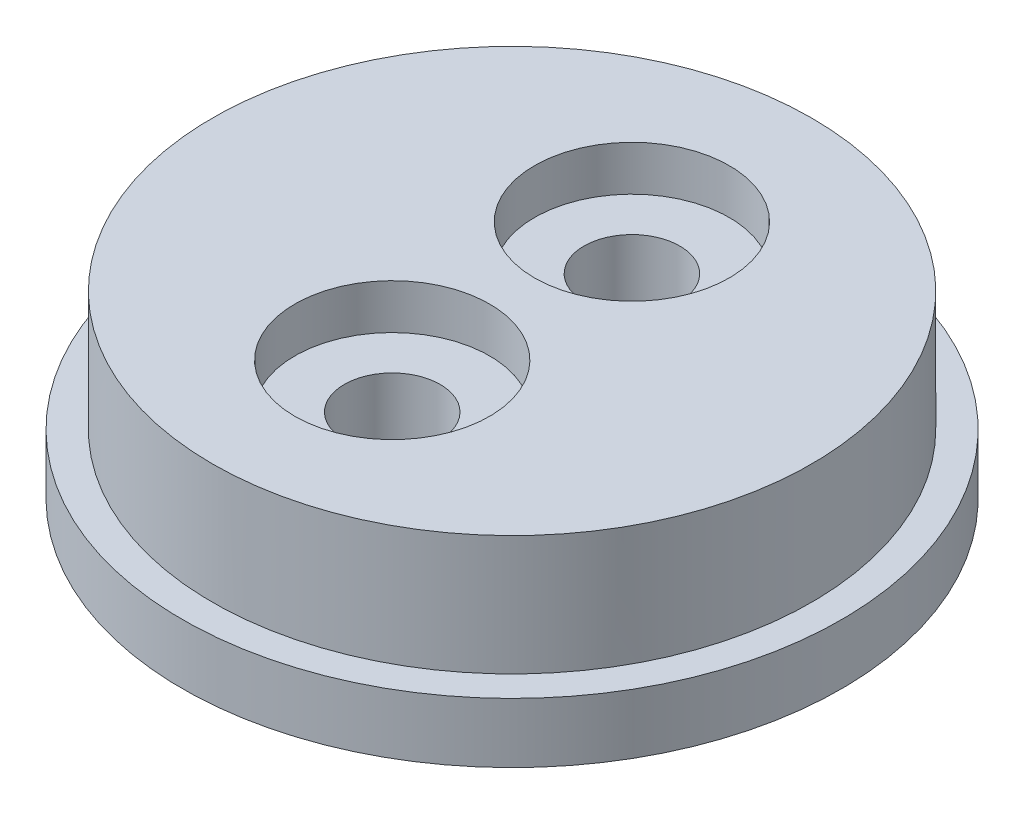
from build123d import *

# Parameters (mm, degrees)
SKETCH1_R           = 10
BOSS_EXTRUDE1_DEPTH = 6
SKETCH2_R           = 3.25
CUT_EXTRUDE1_DEPTH  = 1.5
SKETCH4_R           = 11
BOSS_EXTRUDE2_DEPTH = 2
SKETCH3_R           = 1.6
CUT_EXTRUDE2_DEPTH  = 17.673332001


with BuildPart() as part:
    # Sketch1 → Boss-Extrude1 (new body)
    with BuildSketch(Plane(origin=(0, 0, 0), x_dir=(1, 0, 0), z_dir=(0, 1, 0))):
        Circle(SKETCH1_R)
    extrude(amount=BOSS_EXTRUDE1_DEPTH)

    # Sketch2 → Cut-Extrude1 (cut)
    with BuildSketch(Plane(origin=(0, 6, 0), x_dir=(1, 0, 0), z_dir=(0, 1, 0))):
        with Locations((0, 4)):
            Circle(SKETCH2_R)
        with Locations((0, -4)):
            Circle(SKETCH2_R)
    extrude(amount=-CUT_EXTRUDE1_DEPTH, mode=Mode.SUBTRACT)

    # Sketch4 → Boss-Extrude2 (add)
    with BuildSketch(Plane.XZ):
        Circle(SKETCH4_R)
    extrude(amount=-BOSS_EXTRUDE2_DEPTH)

    # Sketch3 → Cut-Extrude2 (cut, through all)
    with BuildSketch(Plane(origin=(0, 6, 0), x_dir=(1, 0, 0), z_dir=(0, 1, 0))):
        with Locations((0, 4)):
            Circle(SKETCH3_R)
        with Locations((0, -4)):
            Circle(SKETCH3_R)
    extrude(amount=-CUT_EXTRUDE2_DEPTH, mode=Mode.SUBTRACT)


solid = part.part
